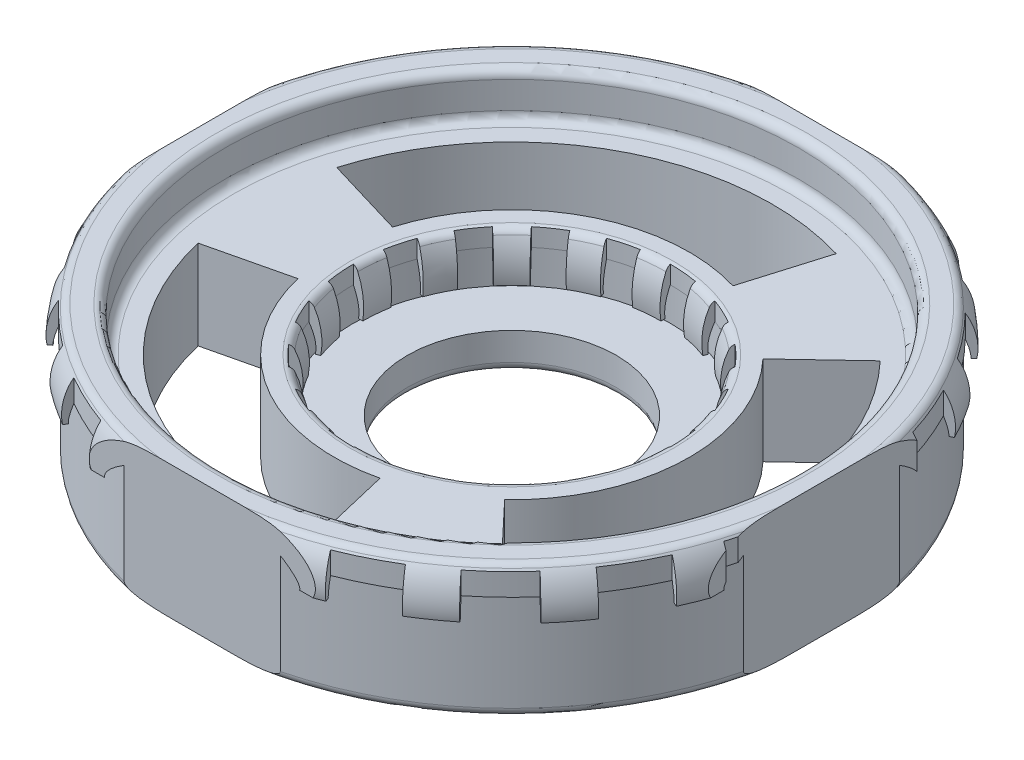
from build123d import *

# Parameters (mm, degrees)
CUT_EXTRUDE1_DEPTH      = 112.138313872
CIRPATTERN1_COUNT       = 3
CUT_EXTRUDE2_DEPTH      = 12
CIRPATTERN2_COUNT       = 18
CUT_EXTRUDE3_DEPTH      = 12
CIRPATTERN3_COUNT       = 21
CUT_EXTRUDE4_DEPTH      = 112.172465481
CUT_EXTRUDE4_DEPTH_BACK = 112.172465481
SKETCH5_W               = 191.08645776
SKETCH5_H               = 170.031193184
SKETCH5_W_2             = 145
SKETCH5_H_2             = 145


with BuildPart() as part:
    # Sketch1 → Revolve1 (revolve)
    with BuildSketch(Plane.XY):
        with BuildLine():
            Line((37.901405046, 10.709173785), (65.200395387, 10.709173785))
            ThreePointArc((65.200395387, 10.709173785), (66.614608949, 11.294960223), (67.200395387, 12.709173785))
            Line((67.200395387, 12.709173785), (67.200395387, 19.034082861))
            ThreePointArc((67.200395387, 19.034082861), (67.786181825, 20.448296423), (69.200395387, 21.034082861))
            Line((69.200395387, 21.034082861), (73.171763988, 21.034082861))
            ThreePointArc((73.171763988, 21.034082861), (74.063017323, 20.824520654), (74.767497643, 20.239750353))
            add(Edge.make_bspline(
                [(74.767497643, 20.239750353), (76.697830569, 17.684902326), (77.618522048, 13.752268129), (77, 10.618546724)],
                knots=[0.096277775, 0.096277775, 0.096277775, 0.096277775, 1, 1, 1, 1], degree=3))
            Line((77, 10.618546724), (76, 10.618546724))
            add(Edge.make_bspline(
                [(76, 10.618546724), (76.163242482, 11.944172331), (74.767497643, 15.389302088)],
                knots=[0, 0, 0, 1, 1, 1], degree=2))
            Line((74.767497643, 15.389302088), (74.767497643, -8.143652668))
            ThreePointArc((74.767497643, -8.143652668), (74.181711206, -9.557866231), (72.767497643, -10.143652668))
            Line((72.767497643, -10.143652668), (26.466934027, -10.143652668))
            ThreePointArc((26.466934027, -10.143652668), (25.052720465, -9.557866231), (24.466934027, -8.143652668))
            Line((24.466934027, -8.143652668), (24.466934027, -1.637809309))
            Line((24.466934027, -1.637809309), (37.284432284, -1.637809309))
            Line((37.284432284, -1.637809309), (37.284432284, 6.720353189))
            add(Edge.make_bspline(
                [(35.9, 0.090627062), (35.374408693, 2.900306006), (37.284432284, 6.720353189)],
                knots=[0, 0, 0, 1, 1, 1], degree=2))
            Line((35.9, 0.090627062), (34.9, 0.090627062))
            add(Edge.make_bspline(
                [(34.9, 0.090627062), (34.409953634, 3.469874743), (34.799674165, 6.609990461), (36.069161594, 9.510974217)],
                knots=[0, 0, 0, 0, 0.877750138, 0.877750138, 0.877750138, 0.877750138], degree=3))
            ThreePointArc((36.069161594, 9.510974217), (36.80678202, 10.383031734), (37.901405046, 10.709173785))
        make_face()
    revolve(axis=Axis((0, 0, 0), (0, 1, 0)))

    # Sketch2 → Cut-Extrude1 (cut, through all)
    with BuildSketch(Plane(origin=(0, 10.709173785, 0), x_dir=(1, 0, 0), z_dir=(0, 1, 0))):
        with BuildLine():
            Line((28.559663891, -30.245477384), (41.896144658, -44.369180975))
            ThreePointArc((41.896144658, -44.369180975), (60.998796736, -1.74870075), (44.369180975, 41.896144658))
            Line((44.369180975, 41.896144658), (30.245477384, 28.559663891))
            ThreePointArc((30.245477384, 28.559663891), (41.581514164, -1.192050153), (28.559663891, -30.245477384))
        make_face()
    cut_extrude1 = extrude(amount=-CUT_EXTRUDE1_DEPTH, mode=Mode.SUBTRACT)

    # CirPattern1: Cut-Extrude1 ×3 about axis
    cirpattern1_axis = Axis((0, 22.592969637, 0), (0, -1, 0))
    for i in range(1, CIRPATTERN1_COUNT):
        add(cut_extrude1.rotate(cirpattern1_axis, i * 360 / CIRPATTERN1_COUNT), mode=Mode.SUBTRACT)

    # Sketch3 → Cut-Extrude2 (cut)
    with BuildSketch(Plane(origin=(0, 10.709173785, 0), x_dir=(1, 0, 0), z_dir=(0, 1, 0))):
        with BuildLine():
            Line((33.564933364, 5.918403358), (36.536367637, 6.442347391))
            ThreePointArc((36.536367637, 6.442347391), (36.958823299, 3.233478056), (37.1, 0))
            Line((37.1, 0), (34.082726564, 0))
            ThreePointArc((34.082726564, 0), (33.9530315, 2.970505349), (33.564933364, 5.918403358))
        make_face()
    cut_extrude2 = extrude(amount=-CUT_EXTRUDE2_DEPTH, mode=Mode.SUBTRACT)

    # CirPattern2: Cut-Extrude2 ×18 about axis
    cirpattern2_axis = Axis((0, 22.592969637, 0), (0, -1, 0))
    for i in range(1, CIRPATTERN2_COUNT):
        add(cut_extrude2.rotate(cirpattern2_axis, i * 360 / CIRPATTERN2_COUNT), mode=Mode.SUBTRACT)

    # Sketch4 → Cut-Extrude3 (cut)
    with BuildSketch(Plane(origin=(0, 21.034082861, 0), x_dir=(1, 0, 0), z_dir=(0, 1, 0))):
        with BuildLine():
            Line((73.938057287, 13.037274401), (78.127162286, 13.775926637))
            ThreePointArc((78.127162286, 13.775926637), (79.030515965, 6.91427422), (79.332399697, 0))
            Line((79.332399697, 0), (75.078671, 0))
            ThreePointArc((75.078671, 0), (74.79297399, 6.543537336), (73.938057287, 13.037274401))
        make_face()
    cut_extrude3 = extrude(amount=-CUT_EXTRUDE3_DEPTH, mode=Mode.SUBTRACT)

    # CirPattern3: Cut-Extrude3 ×21 about axis
    cirpattern3_axis = Axis((0, 22.592969637, 0), (0, -1, 0))
    for i in range(1, CIRPATTERN3_COUNT):
        add(cut_extrude3.rotate(cirpattern3_axis, i * 360 / CIRPATTERN3_COUNT), mode=Mode.SUBTRACT)

    # Sketch5 → Cut-Extrude4 (cut, two sides: drawn at the far end of the back side and taken through both)
    with BuildSketch(Plane(origin=(0, 0, 0), x_dir=(1, 0, 0), z_dir=(0, 1, 0)).offset(-CUT_EXTRUDE4_DEPTH_BACK)):
        with Locations((-2.768826705, -0.954104581)):
            Rectangle(SKETCH5_W, SKETCH5_H)
        Rectangle(SKETCH5_W_2, SKETCH5_H_2, mode=Mode.SUBTRACT)
    extrude(amount=CUT_EXTRUDE4_DEPTH + CUT_EXTRUDE4_DEPTH_BACK, mode=Mode.SUBTRACT)


solid = part.part
